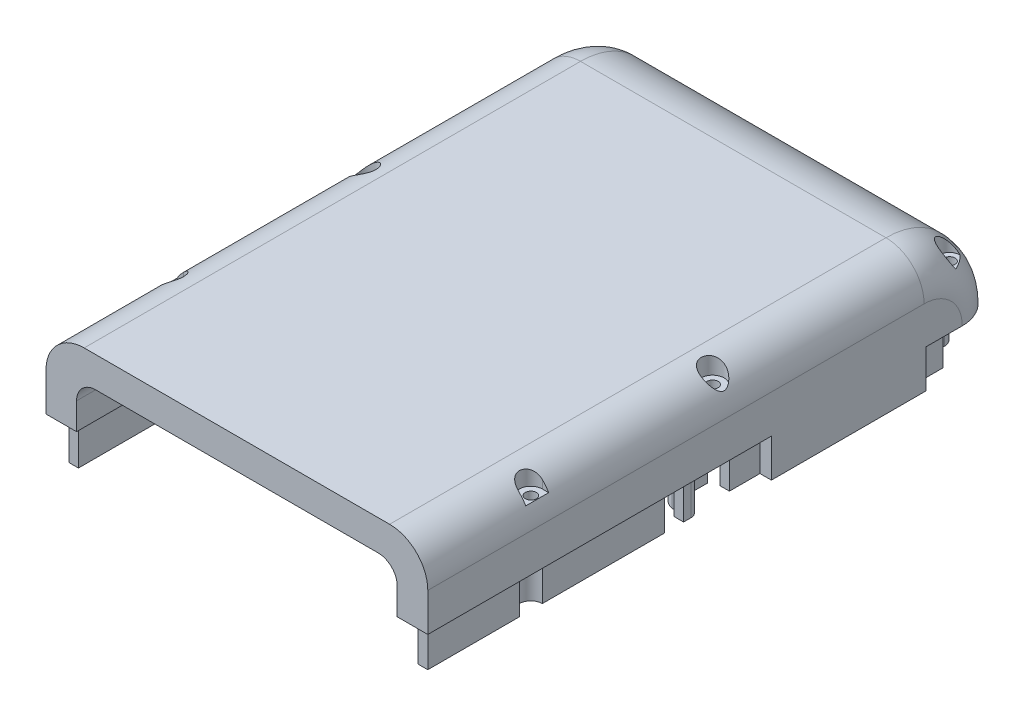
from build123d import *

# Parameters (mm, degrees)
SKETCH_1_W                       = 100
SKETCH_1_H                       = 150
EXTRUDE_1_DEPTH                  = 20
FILLET_4_R                       = 10
FILLET_5_R                       = 20
SHELL_6_T                        = -3
SKETCH_5_W                       = 3
SKETCH_5_H                       = 40.5
EXTRUDE_2_DEPTH                  = 10
SKETCH_6_W                       = 2.5
SKETCH_6_H                       = 56
EXTRUDE_3_DEPTH                  = 10
EXTRUDE_3_DIRECTION_2_REACH      = 94.331
EXTRUDE_4_DEPTH                  = 11
EXTRUDE_4_DIRECTION_2_REACH      = 94.331
EXTRUDE_13_REACH                 = 94.331
SKETCH_23_R                      = 3
EXTRUDE_5_REACH                  = 94.331
EXTRUDE_6_REACH                  = 94.331
CUT_EXTRUDE_1_DEPTH              = 10
CUT_EXTRUDE_1_DEPTH_BACK         = 93.330926563
SKETCH_11_R                      = 1.45
EXTRUDE_7_DEPTH                  = 10
SKETCH_15_R                      = 3
CUT_EXTRUDE_4_DEPTH              = 5
SKETCH_16_R                      = 2.8
CUT_EXTRUDE_5_DEPTH              = 8
EXTRUDE_11_DEPTH                 = 3
SKETCH_21_W                      = 1.5
SKETCH_21_H                      = 16.986459988
SKETCH_21_H_2                    = 18.55
EXTRUDE_10_DEPTH                 = 1.5
SKETCH_27_R                      = 5.4
SKETCH_27_W                      = 18
SKETCH_27_H                      = 10
EXTRUDE_16_DEPTH                 = 10
CUT_EXTRUDE_9_REACH              = 112.073
CUT_EXTRUDE_9_END_RADIUS         = 5.4
SKETCH_28_R                      = 1.369837448
SKETCH_28_R_2                    = 1.365389912
FILLET_3_R                       = 1
CUT_EXTRUDE_11_DEPTH             = 20
CUT_EXTRUDE_11_DIRECTION_2_REACH = 161.374
EXTRUDE_18_DEPTH                 = 10
CUT_EXTRUDE_12_DEPTH             = 1


with BuildPart() as part:
    # 草图1 → 凸台-拉伸1 (new body)
    with BuildSketch(Plane(origin=(0, 0, 0), x_dir=(1, 0, 0), z_dir=(0, 1, 0))):
        Rectangle(SKETCH_1_W, SKETCH_1_H)
    extrude(amount=EXTRUDE_1_DEPTH)

    # 圆角4
    fillet_4_edges = [part.edges().sort_by_distance(p)[0] for p in [
        (50, 20, 0),
        (-50, 20, 0),
        (-50, 10, -75),
        (50, 10, -75),
    ]]
    fillet(fillet_4_edges, radius=FILLET_4_R)

    # 圆角5
    # the kernel refuses this fillet: 20 mm, written as the material it takes off along each edge
    with BuildSketch(Plane(origin=(-50, 0, -55), x_dir=(0, 1, 0), z_dir=(0, 0, 1))) as fillet_5_piece_1:
        with BuildLine():
            CenterArc((10, -10), 10, 0, 90)
            Line((20, -10), (20, 0))
            Line((20, 0), (10, 0))
        make_face()
    revolve(axis=Axis((-50, 0, -55), (-1, 0, 0)), revolution_arc=90, mode=Mode.SUBTRACT)
    with BuildSketch(Plane(origin=(50, 0, -55), x_dir=(0, 0, -1), z_dir=(0, -1, 0))) as fillet_5_piece_2:
        with BuildLine():
            CenterArc((10, -10), 10, 0, 90)
            Line((20, -10), (20, 0))
            Line((20, 0), (10, 0))
        make_face()
    revolve(axis=Axis((50, 0, -55), (1, 0, 0)), revolution_arc=90, mode=Mode.SUBTRACT)
    with BuildSketch(Plane(origin=(50, 20, -75), x_dir=(0, -1, 0), z_dir=(-1, 0, 0))) as fillet_5_piece_3:
        with BuildLine():
            CenterArc((FILLET_5_R, FILLET_5_R), FILLET_5_R, 180, 90)
            Line((0, FILLET_5_R), (0, 0))
            Line((0, 0), (FILLET_5_R, 0))
        make_face()
    extrude(amount=100, mode=Mode.SUBTRACT)

    # 抽壳6
    shell_6_openings = [part.faces().sort_by_distance(p)[0] for p in [
        (0, 0, 0.208807955),
    ]]
    offset(amount=SHELL_6_T, openings=shell_6_openings)

    # 草图5 → 凸台-拉伸2 (add)
    with BuildSketch(Plane.XZ):
        with Locations((48.5, -35.25)):
            Rectangle(SKETCH_5_W, SKETCH_5_H)
        with Locations((-48.5, -35.25)):
            Rectangle(SKETCH_5_W, SKETCH_5_H)
    extrude(amount=EXTRUDE_2_DEPTH)

    # 草图6 → 凸台-拉伸3 (add)
    with BuildSketch(Plane.XZ):
        with Locations((45.75, -35)):
            Rectangle(SKETCH_6_W, SKETCH_6_H)
        with Locations((-45.75, -35)):
            Rectangle(SKETCH_6_W, SKETCH_6_H)
    extrude(amount=EXTRUDE_3_DEPTH)

    # 草图6 → 凸台-拉伸3 direction 2 (add, up to next)
    with BuildSketch(Plane.XZ, mode=Mode.PRIVATE) as extrude_3_direction_2_sk1:
        with Locations((45.75, -35)):
            Rectangle(SKETCH_6_W, SKETCH_6_H)
    extrude_3_direction_2_tool1 = extrude(extrude_3_direction_2_sk1.sketch, amount=-EXTRUDE_3_DIRECTION_2_REACH, mode=Mode.PRIVATE) - part.part
    # 草图6 → 凸台-拉伸3 direction 2 (add, up to next)
    with BuildSketch(Plane.XZ, mode=Mode.PRIVATE) as extrude_3_direction_2_sk2:
        with Locations((-45.75, -35)):
            Rectangle(SKETCH_6_W, SKETCH_6_H)
    extrude_3_direction_2_tool2 = extrude(extrude_3_direction_2_sk2.sketch, amount=-EXTRUDE_3_DIRECTION_2_REACH, mode=Mode.PRIVATE) - part.part
    add(extrude_3_direction_2_tool1.solids().sort_by_distance((45.75, 0, -35))[0])
    add(extrude_3_direction_2_tool2.solids().sort_by_distance((-45.75, 0, -35))[0])

    # 草图7 → 凸台-拉伸4 (add)
    with BuildSketch(Plane.XZ):
        with BuildLine():
            Line((-47, 39.5), (-47, 10.051578841))
            Line((-47, 10.051578841), (-44.5, 10))
            Line((-44.5, 10), (-44.5, 40.101020514))
            ThreePointArc((-44.5, 40.101020514), (-41.5, 45), (-44.5, 49.898979486))
            Line((-44.5, 49.898979486), (-44.5, 72))
            Line((-44.5, 72), (-47, 72))
            Line((-47, 72), (-47, 50.5))
            Line((-47, 50.5), (-47, 48))
            ThreePointArc((-47, 48), (-44, 45), (-47, 42))
            Line((-47, 42), (-47, 39.5))
        make_face()
        with BuildLine():
            Line((47, 72), (44.5, 72))
            Line((44.5, 72), (44.5, 69))
            Line((44.5, 69), (44.5, 49.898979486))
            ThreePointArc((44.5, 49.898979486), (41.5, 45), (44.5, 40.101020514))
            Line((44.5, 40.101020514), (44.5, 10))
            Line((44.5, 10), (47, 10.051578841))
            Line((47, 10.051578841), (47, 39.5))
            Line((47, 39.5), (47, 42))
            ThreePointArc((47, 42), (44, 45), (47, 48))
            Line((47, 48), (47, 50.5))
            Line((47, 50.5), (47, 72))
        make_face()
        with BuildLine():
            Line((47, 3), (47, 5))
            Line((47, 5), (44.485471899, 5))
            ThreePointArc((44.485471899, 5), (43.979696953, 4.052146831), (43.061891595, 3.493696072))
            ThreePointArc((43.061891595, 3.493696072), (42.750579363, 3.430103155), (42.433163974, 3.41572138))
            ThreePointArc((42.433163974, 3.41572138), (39.8250351, 1.859129053), (38.8, -1))
            Line((38.8, -1), (38.8, -7))
            Line((38.8, -7), (41.3, -7))
            Line((41.3, -7), (41.3, -1))
            ThreePointArc((41.3, -1), (41.885786438, 0.414213562), (43.3, 1))
            Line((43.3, 1), (45, 1))
            ThreePointArc((45, 1), (46.414213562, 1.585786438), (47, 3))
        make_face()
        with BuildLine():
            Line((-44.485471899, 5), (-47, 5))
            Line((-47, 5), (-47, 3))
            ThreePointArc((-47, 3), (-46.414213562, 1.585786438), (-45, 1))
            Line((-45, 1), (-43.3, 1))
            ThreePointArc((-43.3, 1), (-41.885786438, 0.414213562), (-41.3, -1))
            Line((-41.3, -1), (-41.3, -7))
            Line((-41.3, -7), (-38.8, -7))
            Line((-38.8, -7), (-38.8, -1))
            ThreePointArc((-38.8, -1), (-39.8250351, 1.859129053), (-42.433163974, 3.41572138))
            ThreePointArc((-42.433163974, 3.41572138), (-42.750579363, 3.430103155), (-43.061891595, 3.493696072))
            ThreePointArc((-43.061891595, 3.493696072), (-43.979696953, 4.052146831), (-44.485471899, 5))
        make_face()
        Polygon((-13.6, -12), (-13.6, -58.5), (-31.6, -58.5), (-31.6, -61), (-11.1, -61), (-11.1, -9.5), (-31.6, -9.5), (-31.6, -12), align=None)
        Polygon((31.6, -61), (11.1, -61), (11.1, -9.5), (31.6, -9.5), (31.6, -12), (13.6, -12), (13.6, -58.5), (31.6, -58.5), align=None)
        with BuildLine():
            Line((38.3, -69.5), (0, -69.5))
            Line((0, -69.5), (0, -72))
            Line((0, -72), (38.3, -72))
            ThreePointArc((38.3, -72), (40.421320344, -71.121320344), (41.3, -69))
            Line((41.3, -69), (41.3, -63.5))
            Line((41.3, -63.5), (38.8, -63.5))
            Line((38.8, -63.5), (38.8, -69))
            ThreePointArc((38.8, -69), (38.653553391, -69.353553391), (38.3, -69.5))
        make_face()
        with BuildLine():
            Line((0, -72), (0, -69.5))
            Line((0, -69.5), (-38.3, -69.5))
            ThreePointArc((-38.3, -69.5), (-38.653553391, -69.353553391), (-38.8, -69))
            Line((-38.8, -69), (-38.8, -63.5))
            Line((-38.8, -63.5), (-41.3, -63.5))
            Line((-41.3, -63.5), (-41.3, -69))
            ThreePointArc((-41.3, -69), (-40.421320344, -71.121320344), (-38.3, -72))
            Line((-38.3, -72), (0, -72))
        make_face()
    extrude(amount=EXTRUDE_4_DEPTH)

    # 草图7 → 凸台-拉伸4 direction 2 (add, up to next)
    with BuildSketch(Plane.XZ, mode=Mode.PRIVATE) as extrude_4_direction_2_sk1:
        with BuildLine():
            Line((-47, 39.5), (-47, 10.051578841))
            Line((-47, 10.051578841), (-44.5, 10))
            Line((-44.5, 10), (-44.5, 40.101020514))
            ThreePointArc((-44.5, 40.101020514), (-41.5, 45), (-44.5, 49.898979486))
            Line((-44.5, 49.898979486), (-44.5, 72))
            Line((-44.5, 72), (-47, 72))
            Line((-47, 72), (-47, 50.5))
            Line((-47, 50.5), (-47, 48))
            ThreePointArc((-47, 48), (-44, 45), (-47, 42))
            Line((-47, 42), (-47, 39.5))
        make_face()
    extrude_4_direction_2_tool1 = extrude(extrude_4_direction_2_sk1.sketch, amount=-EXTRUDE_4_DIRECTION_2_REACH, mode=Mode.PRIVATE) - part.part
    # 草图7 → 凸台-拉伸4 direction 2 (add, up to next)
    with BuildSketch(Plane.XZ, mode=Mode.PRIVATE) as extrude_4_direction_2_sk2:
        with BuildLine():
            Line((47, 72), (44.5, 72))
            Line((44.5, 72), (44.5, 69))
            Line((44.5, 69), (44.5, 49.898979486))
            ThreePointArc((44.5, 49.898979486), (41.5, 45), (44.5, 40.101020514))
            Line((44.5, 40.101020514), (44.5, 10))
            Line((44.5, 10), (47, 10.051578841))
            Line((47, 10.051578841), (47, 39.5))
            Line((47, 39.5), (47, 42))
            ThreePointArc((47, 42), (44, 45), (47, 48))
            Line((47, 48), (47, 50.5))
            Line((47, 50.5), (47, 72))
        make_face()
    extrude_4_direction_2_tool2 = extrude(extrude_4_direction_2_sk2.sketch, amount=-EXTRUDE_4_DIRECTION_2_REACH, mode=Mode.PRIVATE) - part.part
    # 草图7 → 凸台-拉伸4 direction 2 (add, up to next)
    with BuildSketch(Plane.XZ, mode=Mode.PRIVATE) as extrude_4_direction_2_sk3:
        with BuildLine():
            Line((47, 3), (47, 5))
            Line((47, 5), (44.485471899, 5))
            ThreePointArc((44.485471899, 5), (43.979696953, 4.052146831), (43.061891595, 3.493696072))
            ThreePointArc((43.061891595, 3.493696072), (42.750579363, 3.430103155), (42.433163974, 3.41572138))
            ThreePointArc((42.433163974, 3.41572138), (39.8250351, 1.859129053), (38.8, -1))
            Line((38.8, -1), (38.8, -7))
            Line((38.8, -7), (41.3, -7))
            Line((41.3, -7), (41.3, -1))
            ThreePointArc((41.3, -1), (41.885786438, 0.414213562), (43.3, 1))
            Line((43.3, 1), (45, 1))
            ThreePointArc((45, 1), (46.414213562, 1.585786438), (47, 3))
        make_face()
    extrude_4_direction_2_tool3 = extrude(extrude_4_direction_2_sk3.sketch, amount=-EXTRUDE_4_DIRECTION_2_REACH, mode=Mode.PRIVATE) - part.part
    # 草图7 → 凸台-拉伸4 direction 2 (add, up to next)
    with BuildSketch(Plane.XZ, mode=Mode.PRIVATE) as extrude_4_direction_2_sk4:
        with BuildLine():
            Line((-44.485471899, 5), (-47, 5))
            Line((-47, 5), (-47, 3))
            ThreePointArc((-47, 3), (-46.414213562, 1.585786438), (-45, 1))
            Line((-45, 1), (-43.3, 1))
            ThreePointArc((-43.3, 1), (-41.885786438, 0.414213562), (-41.3, -1))
            Line((-41.3, -1), (-41.3, -7))
            Line((-41.3, -7), (-38.8, -7))
            Line((-38.8, -7), (-38.8, -1))
            ThreePointArc((-38.8, -1), (-39.8250351, 1.859129053), (-42.433163974, 3.41572138))
            ThreePointArc((-42.433163974, 3.41572138), (-42.750579363, 3.430103155), (-43.061891595, 3.493696072))
            ThreePointArc((-43.061891595, 3.493696072), (-43.979696953, 4.052146831), (-44.485471899, 5))
        make_face()
    extrude_4_direction_2_tool4 = extrude(extrude_4_direction_2_sk4.sketch, amount=-EXTRUDE_4_DIRECTION_2_REACH, mode=Mode.PRIVATE) - part.part
    # 草图7 → 凸台-拉伸4 direction 2 (add, up to next)
    with BuildSketch(Plane.XZ, mode=Mode.PRIVATE) as extrude_4_direction_2_sk5:
        Polygon((-13.6, -12), (-13.6, -58.5), (-31.6, -58.5), (-31.6, -61), (-11.1, -61), (-11.1, -9.5), (-31.6, -9.5), (-31.6, -12), align=None)
    extrude_4_direction_2_tool5 = extrude(extrude_4_direction_2_sk5.sketch, amount=-EXTRUDE_4_DIRECTION_2_REACH, mode=Mode.PRIVATE) - part.part
    # 草图7 → 凸台-拉伸4 direction 2 (add, up to next)
    with BuildSketch(Plane.XZ, mode=Mode.PRIVATE) as extrude_4_direction_2_sk6:
        Polygon((31.6, -61), (11.1, -61), (11.1, -9.5), (31.6, -9.5), (31.6, -12), (13.6, -12), (13.6, -58.5), (31.6, -58.5), align=None)
    extrude_4_direction_2_tool6 = extrude(extrude_4_direction_2_sk6.sketch, amount=-EXTRUDE_4_DIRECTION_2_REACH, mode=Mode.PRIVATE) - part.part
    # 草图7 → 凸台-拉伸4 direction 2 (add, up to next)
    with BuildSketch(Plane.XZ, mode=Mode.PRIVATE) as extrude_4_direction_2_sk7:
        with BuildLine():
            Line((38.3, -69.5), (0, -69.5))
            Line((0, -69.5), (0, -72))
            Line((0, -72), (38.3, -72))
            ThreePointArc((38.3, -72), (40.421320344, -71.121320344), (41.3, -69))
            Line((41.3, -69), (41.3, -63.5))
            Line((41.3, -63.5), (38.8, -63.5))
            Line((38.8, -63.5), (38.8, -69))
            ThreePointArc((38.8, -69), (38.653553391, -69.353553391), (38.3, -69.5))
        make_face()
    extrude_4_direction_2_tool7 = extrude(extrude_4_direction_2_sk7.sketch, amount=-EXTRUDE_4_DIRECTION_2_REACH, mode=Mode.PRIVATE) - part.part
    # 草图7 → 凸台-拉伸4 direction 2 (add, up to next)
    with BuildSketch(Plane.XZ, mode=Mode.PRIVATE) as extrude_4_direction_2_sk8:
        with BuildLine():
            Line((0, -72), (0, -69.5))
            Line((0, -69.5), (-38.3, -69.5))
            ThreePointArc((-38.3, -69.5), (-38.653553391, -69.353553391), (-38.8, -69))
            Line((-38.8, -69), (-38.8, -63.5))
            Line((-38.8, -63.5), (-41.3, -63.5))
            Line((-41.3, -63.5), (-41.3, -69))
            ThreePointArc((-41.3, -69), (-40.421320344, -71.121320344), (-38.3, -72))
            Line((-38.3, -72), (0, -72))
        make_face()
    extrude_4_direction_2_tool8 = extrude(extrude_4_direction_2_sk8.sketch, amount=-EXTRUDE_4_DIRECTION_2_REACH, mode=Mode.PRIVATE) - part.part
    add(extrude_4_direction_2_tool1.solids().sort_by_distance((-45.429605, 0, 41.181899))[0])
    add(extrude_4_direction_2_tool2.solids().sort_by_distance((45.429605, 0, 41.181899))[0])
    add(extrude_4_direction_2_tool3.solids().sort_by_distance((44.15, 0, 1.145341))[0])
    add(extrude_4_direction_2_tool4.solids().sort_by_distance((-41.783015, 0, 0.516985))[0])
    add(extrude_4_direction_2_tool5.solids().sort_by_distance((-13.045699, 0, -35.25))[0])
    add(extrude_4_direction_2_tool6.solids().sort_by_distance((21.35, 0, -60.445699))[0])
    add(extrude_4_direction_2_tool7.solids().sort_by_distance((22.827309, 0, -70.191937))[0])
    add(extrude_4_direction_2_tool8.solids().sort_by_distance((-22.827309, 0, -70.191937))[0])

    # 草图23 → 凸台-拉伸13 (add, up to next)
    with BuildSketch(Plane(origin=(0, 0, 0), x_dir=(-1, 0, 0), z_dir=(0, -1, 0)), mode=Mode.PRIVATE) as extrude_13_sk1:
        with Locations((47, -45)):
            Circle(SKETCH_23_R)
    extrude_13_tool1 = extrude(extrude_13_sk1.sketch, amount=-EXTRUDE_13_REACH, mode=Mode.PRIVATE) - part.part
    # 草图23 → 凸台-拉伸13 (add, up to next)
    with BuildSketch(Plane(origin=(0, 0, 0), x_dir=(-1, 0, 0), z_dir=(0, -1, 0)), mode=Mode.PRIVATE) as extrude_13_sk2:
        with Locations((-47, -45)):
            Circle(SKETCH_23_R)
    extrude_13_tool2 = extrude(extrude_13_sk2.sketch, amount=-EXTRUDE_13_REACH, mode=Mode.PRIVATE) - part.part
    add(extrude_13_tool1.solids().sort_by_distance((-47, 0, 45))[0])
    add(extrude_13_tool2.solids().sort_by_distance((47, 0, 45))[0])

    # 草图9 → 凸台-拉伸5 (add, up to next)
    with BuildSketch(Plane(origin=(0, 0, 0), x_dir=(-1, 0, 0), z_dir=(0, -1, 0)), mode=Mode.PRIVATE) as extrude_5_sk1:
        with BuildLine():
            Line((-47, 7), (-47, -3))
            ThreePointArc((-47, -3), (-46.414213562, -1.585786438), (-45, -1))
            Line((-45, -1), (-42.8, -1))
            ThreePointArc((-42.8, -1), (-41.385786438, -0.414213562), (-40.8, 1))
            Line((-40.8, 1), (-40.8, 13))
            ThreePointArc((-40.8, 13), (-41.385786438, 14.414213562), (-42.8, 15))
            Line((-42.8, 15), (-44.5, 15))
            Line((-44.5, 15), (-44.5, 7))
            Line((-44.5, 7), (-47, 7))
        make_face()
    extrude_5_tool1 = extrude(extrude_5_sk1.sketch, amount=-EXTRUDE_5_REACH, mode=Mode.PRIVATE) - part.part
    # 草图9 → 凸台-拉伸5 (add, up to next)
    with BuildSketch(Plane(origin=(0, 0, 0), x_dir=(-1, 0, 0), z_dir=(0, -1, 0)), mode=Mode.PRIVATE) as extrude_5_sk2:
        with BuildLine():
            ThreePointArc((40.8, 1), (41.385786438, -0.414213562), (42.8, -1))
            Line((42.8, -1), (45, -1))
            ThreePointArc((45, -1), (46.414213562, -1.585786438), (47, -3))
            Line((47, -3), (47, 7))
            Line((47, 7), (44.5, 7))
            Line((44.5, 7), (44.5, 15))
            Line((44.5, 15), (42.8, 15))
            ThreePointArc((42.8, 15), (41.385786438, 14.414213562), (40.8, 13))
            Line((40.8, 13), (40.8, 1))
        make_face()
    extrude_5_tool2 = extrude(extrude_5_sk2.sketch, amount=-EXTRUDE_5_REACH, mode=Mode.PRIVATE) - part.part
    add(extrude_5_tool1.solids().sort_by_distance((43.514927, 0, -5.886278))[0])
    add(extrude_5_tool2.solids().sort_by_distance((-43.514927, 0, -5.886278))[0])

    # 草图10 → 凸台-拉伸6 (add, up to next)
    with BuildSketch(Plane.XZ, mode=Mode.PRIVATE) as extrude_6_sk1:
        with BuildLine():
            Line((-40, -72), (-40, -62))
            ThreePointArc((-40, -62), (-40.585786438, -60.585786438), (-42, -60))
            Line((-42, -60), (-44.5, -60))
            Line((-44.5, -60), (-44.5, -63))
            Line((-44.5, -63), (-47, -63))
            Line((-47, -63), (-47, -65))
            Line((-47, -65), (-47, -72))
            Line((-47, -72), (-40, -72))
        make_face()
    extrude_6_tool1 = extrude(extrude_6_sk1.sketch, amount=-EXTRUDE_6_REACH, mode=Mode.PRIVATE) - part.part
    # 草图10 → 凸台-拉伸6 (add, up to next)
    with BuildSketch(Plane.XZ, mode=Mode.PRIVATE) as extrude_6_sk2:
        with BuildLine():
            Line((47, -63), (47, -65))
            Line((47, -65), (47, -72))
            Line((47, -72), (40, -72))
            Line((40, -72), (40, -62))
            ThreePointArc((40, -62), (40.585786438, -60.585786438), (42, -60))
            Line((42, -60), (44.5, -60))
            Line((44.5, -60), (44.5, -63))
            Line((44.5, -63), (47, -63))
        make_face()
    extrude_6_tool2 = extrude(extrude_6_sk2.sketch, amount=-EXTRUDE_6_REACH, mode=Mode.PRIVATE) - part.part
    add(extrude_6_tool1.solids().sort_by_distance((-43.311558, 0, -66.509203))[0])
    add(extrude_6_tool2.solids().sort_by_distance((43.311558, 0, -66.509203))[0])

    # 草图11 → 切除-拉伸1 (cut, two sides: drawn at the far end of the back side and taken through both)
    with BuildSketch(Plane.XZ.offset(-CUT_EXTRUDE_1_DEPTH_BACK)):
        with Locations(Location((-45.65, -66, 0), (0, 0, 220.024723099))):
            Circle(SKETCH_11_R)
        with Locations(Location((-45.605138498, -4, 0), (0, 0, 90))):
            Circle(SKETCH_11_R)
        with Locations(Location((-47, 45, 0), (0, 0, 90))):
            Circle(SKETCH_11_R)
        with Locations(Location((47, 45, 0), (0, 0, 90))):
            Circle(SKETCH_11_R)
        with Locations(Location((45.605138498, -4, 0), (0, 0, 90))):
            Circle(SKETCH_11_R)
        with Locations(Location((45.65, -66, 0), (0, 0, 319.975276901))):
            Circle(SKETCH_11_R)
    extrude(amount=CUT_EXTRUDE_1_DEPTH + CUT_EXTRUDE_1_DEPTH_BACK, mode=Mode.SUBTRACT)

    # 草图14 → 凸台-拉伸7 (add)
    with BuildSketch(Plane.XY.offset(75)):
        with BuildLine():
            Line((-42, 0), (-42, 7))
            ThreePointArc((-42, 7), (-40.535533906, 10.535533906), (-37, 12))
            Line((-37, 12), (37, 12))
            ThreePointArc((37, 12), (40.535533906, 10.535533906), (42, 7))
            Line((42, 7), (42, 0))
            Line((42, 0), (40.5, 0))
            Line((40.5, 0), (40.5, 1.5))
            Line((40.5, 1.5), (40.5, 7))
            ThreePointArc((40.5, 7), (39.474873734, 9.474873734), (37, 10.5))
            Line((37, 10.5), (-37, 10.5))
            ThreePointArc((-37, 10.5), (-39.474873734, 9.474873734), (-40.5, 7))
            Line((-40.5, 7), (-40.5, 1.5))
            Line((-40.5, 1.5), (-40.5, 0))
            Line((-40.5, 0), (-42, 0))
        make_face()
    extrude(amount=EXTRUDE_7_DEPTH)

    # 草图15 → 切除-拉伸4 (cut)
    with BuildSketch(Plane(origin=(0, 20, 0), x_dir=(1, 0, 0), z_dir=(0, 1, 0))):
        with Locations(Location((45.605138498, 4, 0), (0, 0, 270))):
            Circle(SKETCH_15_R)
        with Locations(Location((-45.605138498, 4, 0), (0, 0, 270))):
            Circle(SKETCH_15_R)
        with BuildLine():
            Line((-47, -42), (-50, -42))
            Line((-50, -42), (-50, -48))
            Line((-50, -48), (-47, -48))
            ThreePointArc((-47, -48), (-44, -45), (-47, -42))
        make_face()
        with BuildLine():
            Line((47, -42), (50, -42))
            Line((50, -42), (50, -48))
            Line((50, -48), (47, -48))
            ThreePointArc((47, -48), (44, -45), (47, -42))
        make_face()
    extrude(amount=-CUT_EXTRUDE_4_DEPTH, mode=Mode.SUBTRACT)

    # 草图16 → 切除-拉伸5 (cut)
    with BuildSketch(Plane(origin=(0, 20, 0), x_dir=(1, 0, 0), z_dir=(0, 1, 0))):
        with Locations((-45.65, 66)):
            Circle(SKETCH_16_R)
        with Locations((45.65, 66)):
            Circle(SKETCH_16_R)
    extrude(amount=-CUT_EXTRUDE_5_DEPTH, mode=Mode.SUBTRACT)

    # 草图22 → 凸台-拉伸11 (add)
    with BuildSketch(Plane(origin=(0, -9, 0), x_dir=(-1, 0, 0), z_dir=(0, -1, 0))):
        Polygon((44.5, 15), (41.3, 15), (41.3, 12), (13.6, 12), (13.6, 58.5), (41.3, 58.5), (41.3, 55.469397887), (44.5, 55.469397887), align=None)
        Polygon((-41.3, 15), (-41.3, 12), (-13.6, 12), (-13.6, 58.5), (-41.3, 58.5), (-41.3, 55.469397887), (-44.5, 55.469397887), (-44.5, 15), align=None)
    extrude(amount=-EXTRUDE_11_DEPTH)

    # 草图21 → 凸台-拉伸10 (add)
    with BuildSketch(Plane(origin=(0, 0, -61), x_dir=(-1, 0, 0), z_dir=(0, 0, -1))):
        with Locations((-26.5, -8.493229994)):
            Rectangle(SKETCH_21_W, SKETCH_21_H)
        with Locations((26.5, -9.275)):
            Rectangle(SKETCH_21_W, SKETCH_21_H_2)
    extrude(amount=EXTRUDE_10_DEPTH)

    # 草图27 → 凸台-拉伸16 (add)
    with BuildSketch(Plane(origin=(0, 17, 0), x_dir=(-1, 0, 0), z_dir=(0, -1, 0))):
        with BuildLine():
            Line((4, -16), (-5, -16))
            Line((-5, -16), (-5, -21))
            Line((-5, -21), (-11, -21))
            Line((-11, -21), (-11, -16))
            Line((-11, -16), (-20, -16))
            Line((-20, -16), (-20, 0))
            Line((-20, 0), (4, 0))
            Line((4, 0), (4, -5.438750305))
            ThreePointArc((4, -5.438750305), (17.773023968, -1.898181069), (15, -15.846018098))
            Line((15, -15.846018098), (15, -21))
            Line((15, -21), (9, -21))
            Line((9, -21), (9, -15.846018098))
            ThreePointArc((9, -15.846018098), (5.898181069, -13.773023968), (4, -10.561249695))
            Line((4, -10.561249695), (4, -16))
        make_face()
        with Locations(Location((12, -8, 0), (0, 0, 90))):
            Circle(SKETCH_27_R, mode=Mode.SUBTRACT)
        with Locations((-8, -8)):
            Rectangle(SKETCH_27_W, SKETCH_27_H, mode=Mode.SUBTRACT)
    extrude(amount=EXTRUDE_16_DEPTH)

    # 切除-拉伸9: up to this cylinder (the profile starts outside it)
    cut_extrude_9_end = Plane(origin=(-12, 12, 8), z_dir=(0, 1, 0)) * Cylinder(CUT_EXTRUDE_9_END_RADIUS, 235.946, mode=Mode.PRIVATE)
    # 草图28 → 切除-拉伸9 (cut, up to the surface)
    with BuildSketch(Plane.XY.offset(21), mode=Mode.PRIVATE) as cut_extrude_9_sk1:
        with Locations((-12, 12)):
            Circle(SKETCH_28_R)
        with Locations((-12, 12)):
            Circle(SKETCH_28_R_2, mode=Mode.SUBTRACT)
    cut_extrude_9_tool1 = extrude(cut_extrude_9_sk1.sketch, amount=-CUT_EXTRUDE_9_REACH, mode=Mode.PRIVATE) - cut_extrude_9_end
    add(cut_extrude_9_tool1.solids().sort_by_distance((-13.365963, 12, 21))[0], mode=Mode.SUBTRACT)


with BuildPart() as cut_extrude_9_kept_piece:
    # of the separate pieces the step leaves, the one the design keeps (cut_extrude_9_pieces_kept)
    add(part.part.solids().sort_by_distance((40, 0, -75))[0])

    # 圆角3
    fillet_3_edges = [cut_extrude_9_kept_piece.edges().sort_by_distance(p)[0] for p in [
        (-4, 7, 13.280624847),
        (-5.898181069, 7, 13.773023968),
        (-9, 7, 18.423009049),
        (-12, 7, 21),
        (-15, 7, 18.423009049),
        (-17.773023968, 7, 1.898181069),
        (-4, 7, 2.719375153),
        (8, 7, 0),
        (20, 7, 8),
        (15.5, 7, 16),
        (11, 7, 18.5),
        (8, 7, 21),
        (5, 7, 18.5),
        (0.5, 7, 16),
        (-4, 12, 10.561249695),
        (-4, 12, 5.438750305),
        (-12, 7, 13.4),
        (-1, 7, 8),
        (8, 7, 3),
        (17, 7, 8),
        (8, 7, 13),
    ]]
    fillet(fillet_3_edges, radius=FILLET_3_R)

    # 草图13 → 切除-拉伸11 (cut)
    with BuildSketch(Plane.XY.offset(75)):
        with BuildLine():
            Line((-42, 0), (42, 0))
            Line((42, 0), (42, 7))
            ThreePointArc((42, 7), (40.535533906, 10.535533906), (37, 12))
            Line((37, 12), (-37, 12))
            ThreePointArc((-37, 12), (-40.535533906, 10.535533906), (-42, 7))
            Line((-42, 7), (-42, 0))
        make_face()
    extrude(amount=CUT_EXTRUDE_11_DEPTH, mode=Mode.SUBTRACT)

    # 草图13 → 切除-拉伸11 direction 2 (cut, up to next)
    with BuildSketch(Plane.XY.offset(75), mode=Mode.PRIVATE) as cut_extrude_11_direction_2_sk1:
        with BuildLine():
            Line((-42, 0), (42, 0))
            Line((42, 0), (42, 7))
            ThreePointArc((42, 7), (40.535533906, 10.535533906), (37, 12))
            Line((37, 12), (-37, 12))
            ThreePointArc((-37, 12), (-40.535533906, 10.535533906), (-42, 7))
            Line((-42, 7), (-42, 0))
        make_face()
    cut_extrude_11_direction_2_tool1 = extrude(cut_extrude_11_direction_2_sk1.sketch, amount=-CUT_EXTRUDE_11_DIRECTION_2_REACH, mode=Mode.PRIVATE) & cut_extrude_9_kept_piece.part
    add(cut_extrude_11_direction_2_tool1.solids().sort_by_distance((0, 5.94746, 75))[0], mode=Mode.SUBTRACT)

    # 草图30 → 凸台-拉伸18 (add)
    with BuildSketch(Plane(origin=(0, 0, 72), x_dir=(-1, 0, 0), z_dir=(0, 0, -1))):
        with BuildLine():
            Line((-43.5, 0), (-43.5, 7))
            ThreePointArc((-43.5, 7), (-41.596194078, 11.596194078), (-37, 13.5))
            Line((-37, 13.5), (37, 13.5))
            ThreePointArc((37, 13.5), (41.596194078, 11.596194078), (43.5, 7))
            Line((43.5, 7), (43.5, 0))
            Line((43.5, 0), (42, 0))
            Line((42, 0), (42, 7))
            ThreePointArc((42, 7), (40.535533906, 10.535533906), (37, 12))
            Line((37, 12), (-37, 12))
            ThreePointArc((-37, 12), (-40.535533906, 10.535533906), (-42, 7))
            Line((-42, 7), (-42, 0))
            Line((-42, 0), (-43.5, 0))
        make_face()
    extrude(amount=EXTRUDE_18_DEPTH)

    # 草图31 → 切除-拉伸12 (cut)
    with BuildSketch(Plane.XZ.offset(11)):
        Polygon((27.25, -61), (31.6, -61), (31.6, -58.5), (13.6, -58.5), (13.6, -12), (31.6, -12), (31.6, -9.5), (11.1, -9.5), (11.1, -61), (25.75, -61), align=None)
        Polygon((-13.6, -12), (-13.6, -58.5), (-31.6, -58.5), (-31.6, -61), (-27.25, -61), (-25.75, -61), (-11.1, -61), (-11.1, -9.5), (-31.6, -9.5), (-31.6, -12), align=None)
    extrude(amount=-CUT_EXTRUDE_12_DEPTH, mode=Mode.SUBTRACT)


solid = cut_extrude_9_kept_piece.part
